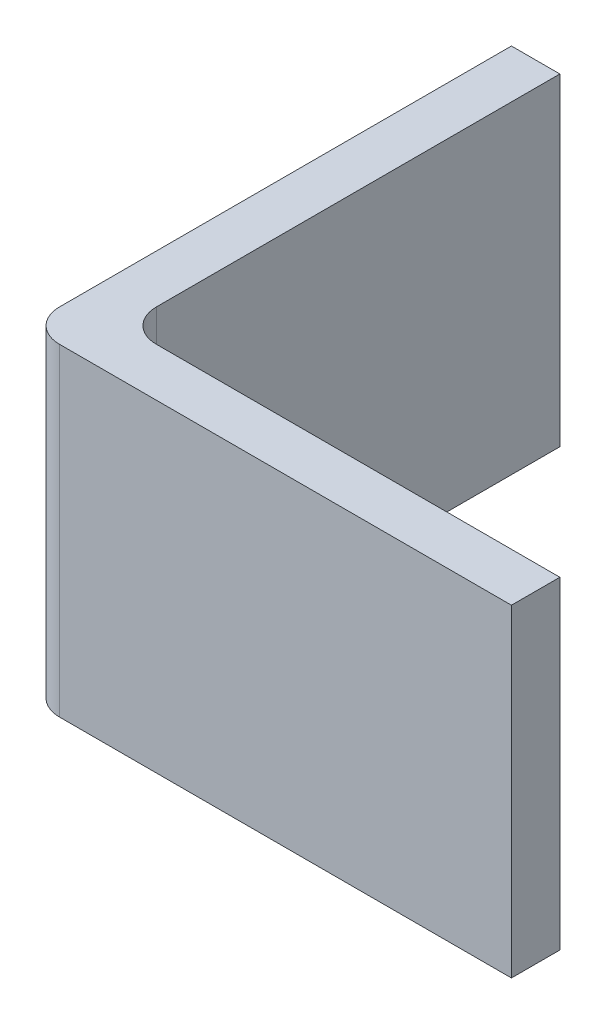
from build123d import *

# Parameters (mm, degrees)
EXTRUDE_1_DEPTH = 10


with BuildPart() as part:
    # Эскиз1 → Бобышка-Вытянуть1 (new body)
    with BuildSketch(Plane(origin=(0, 0, 0), x_dir=(1, 0, 0), z_dir=(0, 1, 0))):
        with BuildLine():
            Line((0, 1), (0, 15))
            Line((0, 15), (1.5, 15))
            Line((1.5, 15), (1.5, 2.5))
            ThreePointArc((1.5, 2.5), (1.792893219, 1.792893219), (2.5, 1.5))
            Line((2.5, 1.5), (15, 1.5))
            Line((15, 1.5), (15, 0))
            Line((15, 0), (1, 0))
            ThreePointArc((1, 0), (0.292893219, 0.292893219), (0, 1))
        make_face()
    extrude(amount=EXTRUDE_1_DEPTH)


solid = part.part
